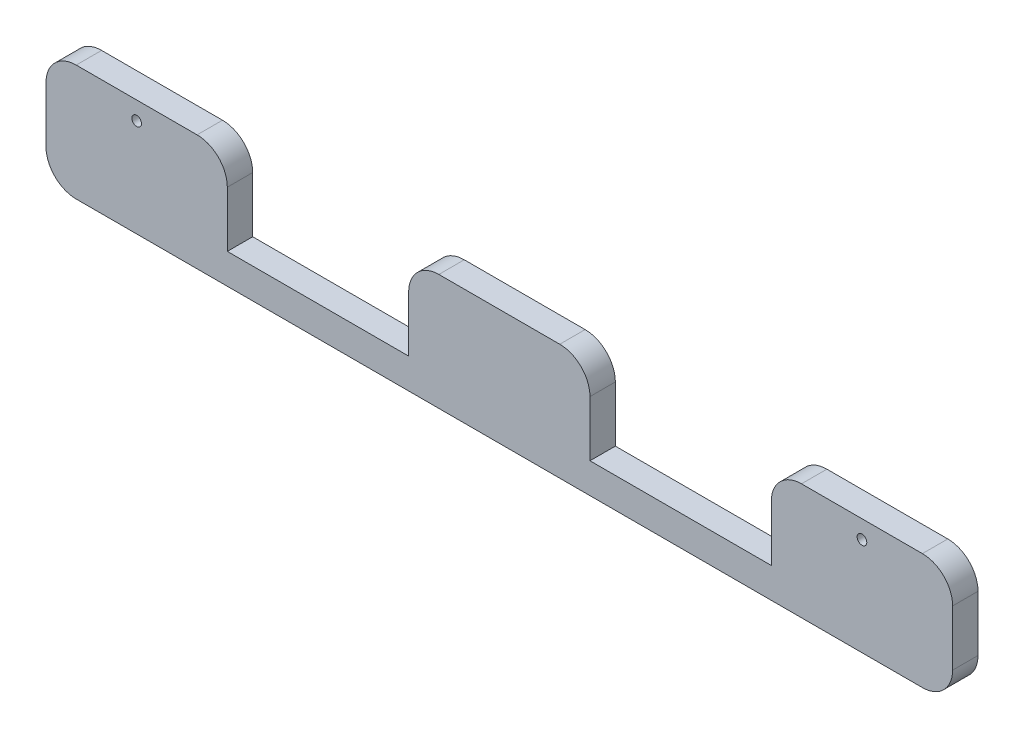
from build123d import *

# Parameters (mm, degrees)
SKETCH1_W           = 190.5
SKETCH1_H           = 24.384
BOSS_EXTRUDE1_DEPTH = 5.334
SKETCH3_W           = 38.1
SKETCH3_H           = 18.034
CUT_EXTRUDE1_DEPTH  = 122.162721385
SKETCH4_R           = 1.016
CUT_EXTRUDE2_DEPTH  = 122.162721385
FILLET1_R           = 6.35


with BuildPart() as part:
    # Sketch1 → Boss-Extrude1 (new body)
    with BuildSketch(Plane.XY):
        with Locations((10.187554582, -47.262819662)):
            Rectangle(SKETCH1_W, SKETCH1_H)
    extrude(amount=BOSS_EXTRUDE1_DEPTH)

    # Sketch3 → Cut-Extrude1 (cut, through all)
    with BuildSketch(Plane.XY.offset(5.334)):
        with Locations((-27.912445418, -44.087819662)):
            Rectangle(SKETCH3_W, SKETCH3_H)
        with Locations((48.287554582, -44.087819662)):
            Rectangle(SKETCH3_W, SKETCH3_H)
    extrude(amount=-CUT_EXTRUDE1_DEPTH, mode=Mode.SUBTRACT)

    # Sketch4 → Cut-Extrude2 (cut, through all)
    with BuildSketch(Plane.XY.offset(5.334)):
        with Locations((-66.012445418, -38.880819662)):
            Circle(SKETCH4_R)
        with Locations((86.387554582, -38.880819662)):
            Circle(SKETCH4_R)
    extrude(amount=-CUT_EXTRUDE2_DEPTH, mode=Mode.SUBTRACT)

    # Fillet1
    fillet1_edges = [part.edges().sort_by_distance(p)[0] for p in [
        (29.237554582, -35.070819662, 2.667),
        (-8.862445418, -35.070819662, 2.667),
        (-46.962445418, -35.070819662, 2.667),
        (67.337554582, -35.070819662, 2.667),
        (105.437554582, -35.070819662, 2.667),
        (105.437554582, -59.454819662, 2.667),
        (-85.062445418, -59.454819662, 2.667),
        (-85.062445418, -35.070819662, 2.667),
    ]]
    fillet(fillet1_edges, radius=FILLET1_R)


solid = part.part
